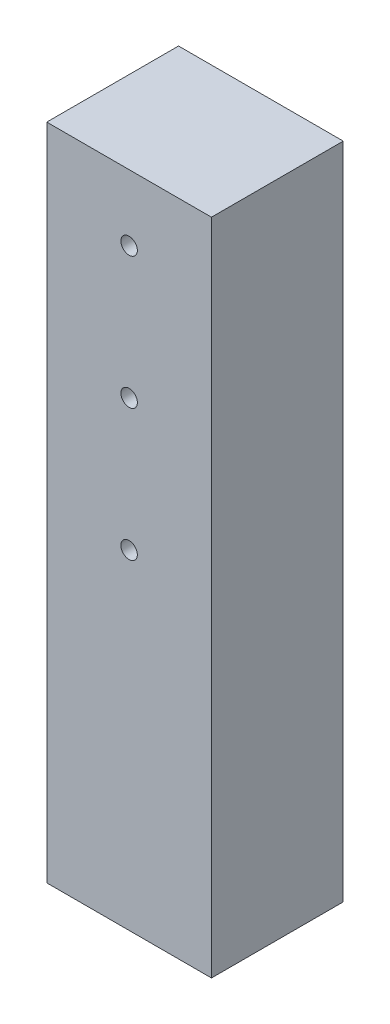
from build123d import *

# Parameters (mm, degrees)
SKETCH1_R           = 1.6
BOSS_EXTRUDE1_DEPTH = 100
SKETCH2_W           = 8.75
SKETCH2_H           = 20
CUT_EXTRUDE1_DEPTH  = 100
SKETCH3_W           = 25
SKETCH3_H           = 20
BOSS_EXTRUDE2_DEPTH = 60
SKETCH4_R           = 1.25
CUT_EXTRUDE2_DEPTH  = 60


with BuildPart() as part:
    # Sketch1 → Boss-Extrude1 (new body)
    with BuildSketch(Plane(origin=(0, 0, 0), x_dir=(1, 0, 0), z_dir=(0, 1, 0))):
        Polygon((-17.25, -10), (17.25, -10), (25.25, -10), (25.25, 10), (17.25, 10), (-17.25, 10), align=None)
        with Locations((-5, 5)):
            Circle(SKETCH1_R, mode=Mode.SUBTRACT)
        with Locations((13, 5)):
            Circle(SKETCH1_R, mode=Mode.SUBTRACT)
        with Locations((-5, -5)):
            Circle(SKETCH1_R, mode=Mode.SUBTRACT)
        with Locations((13, -5)):
            Circle(SKETCH1_R, mode=Mode.SUBTRACT)
    extrude(amount=BOSS_EXTRUDE1_DEPTH)

    # Sketch2 → Cut-Extrude1 (cut)
    with BuildSketch(Plane.XZ):
        with Locations((-12.875, 0)):
            Rectangle(SKETCH2_W, SKETCH2_H)
        with Locations((20.875, 0)):
            Rectangle(SKETCH2_W, SKETCH2_H)
    extrude(amount=-CUT_EXTRUDE1_DEPTH, mode=Mode.SUBTRACT)

    # Sketch3 → Boss-Extrude2 (add)
    with BuildSketch(Plane(origin=(0, 100, 0), x_dir=(1, 0, 0), z_dir=(0, 1, 0))):
        with Locations((4, 0)):
            Rectangle(SKETCH3_W, SKETCH3_H)
    extrude(amount=-BOSS_EXTRUDE2_DEPTH)

    # Sketch4 → Cut-Extrude2 (cut)
    with BuildSketch(Plane.XY.offset(10)):
        with Locations((4, 50)):
            Circle(SKETCH4_R)
        with Locations((4, 70)):
            Circle(SKETCH4_R)
        with Locations((4, 90)):
            Circle(SKETCH4_R)
    extrude(amount=-CUT_EXTRUDE2_DEPTH, mode=Mode.SUBTRACT)


solid = part.part
